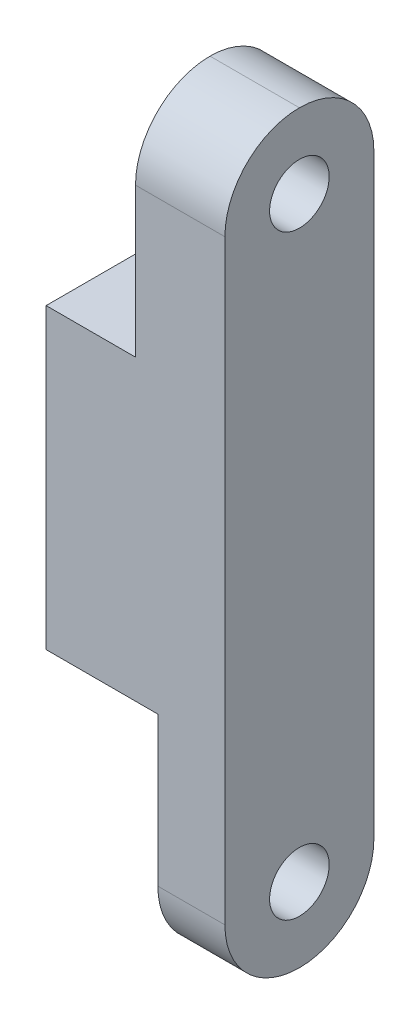
from build123d import *

# Parameters (mm, degrees)
SKETCH1_W           = 12
SKETCH1_H           = 50
BOSS_EXTRUDE1_DEPTH = 10
SKETCH2_W           = 7.5
SKETCH2_H           = 15
SKETCH2_W_2         = 6
CUT_EXTRUDE1_DEPTH  = 10
SKETCH3_R           = 2
CUT_EXTRUDE2_DEPTH  = 10
FILLET1_R           = 5


with BuildPart() as part:
    # Sketch1 → Boss-Extrude1 (new body)
    with BuildSketch(Plane.XY):
        Rectangle(SKETCH1_W, SKETCH1_H)
    extrude(amount=BOSS_EXTRUDE1_DEPTH)

    # Sketch2 → Cut-Extrude1 (cut)
    with BuildSketch(Plane.XY.offset(10)):
        with Locations((-2.25, -17.5)):
            Rectangle(SKETCH2_W, SKETCH2_H)
        with Locations((-3, 17.5)):
            Rectangle(SKETCH2_W_2, SKETCH2_H)
    extrude(amount=-CUT_EXTRUDE1_DEPTH, mode=Mode.SUBTRACT)

    # Sketch3 → Cut-Extrude2 (cut)
    with BuildSketch(Plane.ZY):
        with Locations(Location((5, 20, 0), (0, 0, 270))):
            Circle(SKETCH3_R)
        with Locations(Location((5, -20, 0), (0, 0, 270))):
            Circle(SKETCH3_R)
    extrude(amount=-CUT_EXTRUDE2_DEPTH, mode=Mode.SUBTRACT)

    # Fillet1
    fillet1_edges = [part.edges().sort_by_distance(p)[0] for p in [
        (3.75, -25, 0),
        (3.75, -25, 10),
        (3, 25, 0),
        (3, 25, 10),
    ]]
    fillet(fillet1_edges, radius=FILLET1_R - 0.0001)  # a hair under: the kernel refuses the full size


solid = part.part
